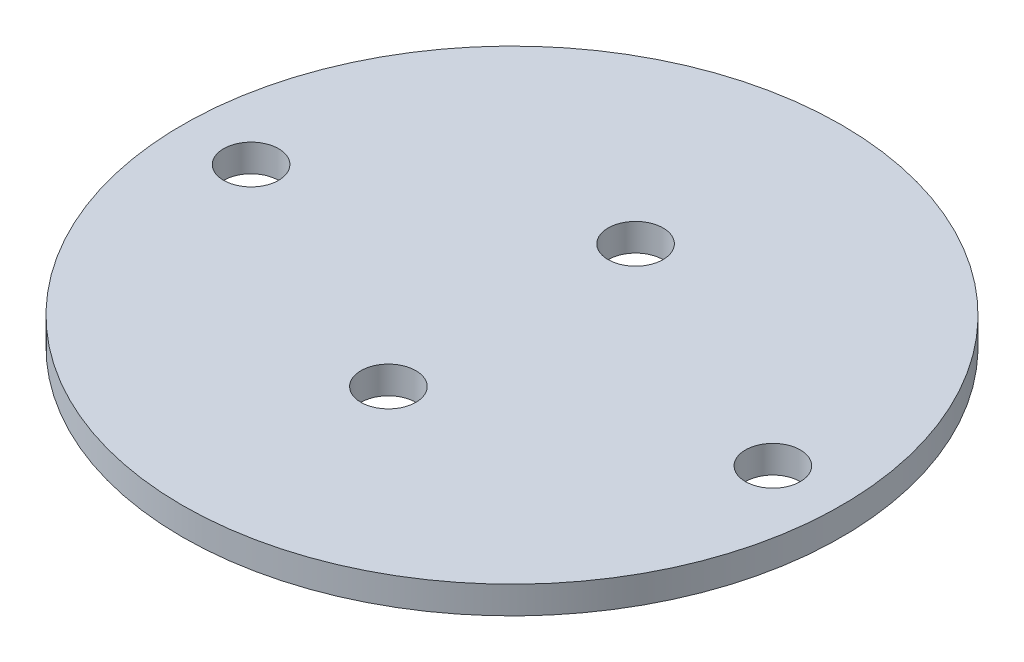
from build123d import *

# Parameters (mm, degrees)
SKETCH1_R           = 36
SKETCH1_R_2         = 3
BOSS_EXTRUDE1_DEPTH = 3


with BuildPart() as part:
    # Sketch1 → Boss-Extrude1 (new body)
    with BuildSketch(Plane(origin=(0, 0, 0), x_dir=(1, 0, 0), z_dir=(0, 1, 0))):
        with Locations((3.941504792, 0)):
            Circle(SKETCH1_R)
        with BuildLine():
            ThreePointArc((6.941504792, -13.5), (1.820184448, -15.621320344), (3.941504792, -10.5))
            ThreePointArc((3.941504792, -10.5), (6.062825135, -11.378679656), (6.941504792, -13.5))
        make_face(mode=Mode.SUBTRACT)
        with Locations((-24.558495208, 0)):
            Circle(SKETCH1_R_2, mode=Mode.SUBTRACT)
        with BuildLine():
            ThreePointArc((6.941504792, 13.5), (6.062825135, 11.378679656), (3.941504792, 10.5))
            ThreePointArc((3.941504792, 10.5), (1.820184448, 15.621320344), (6.941504792, 13.5))
        make_face(mode=Mode.SUBTRACT)
        with Locations((32.441504792, 0)):
            Circle(SKETCH1_R_2, mode=Mode.SUBTRACT)
    extrude(amount=-BOSS_EXTRUDE1_DEPTH)


solid = part.part
